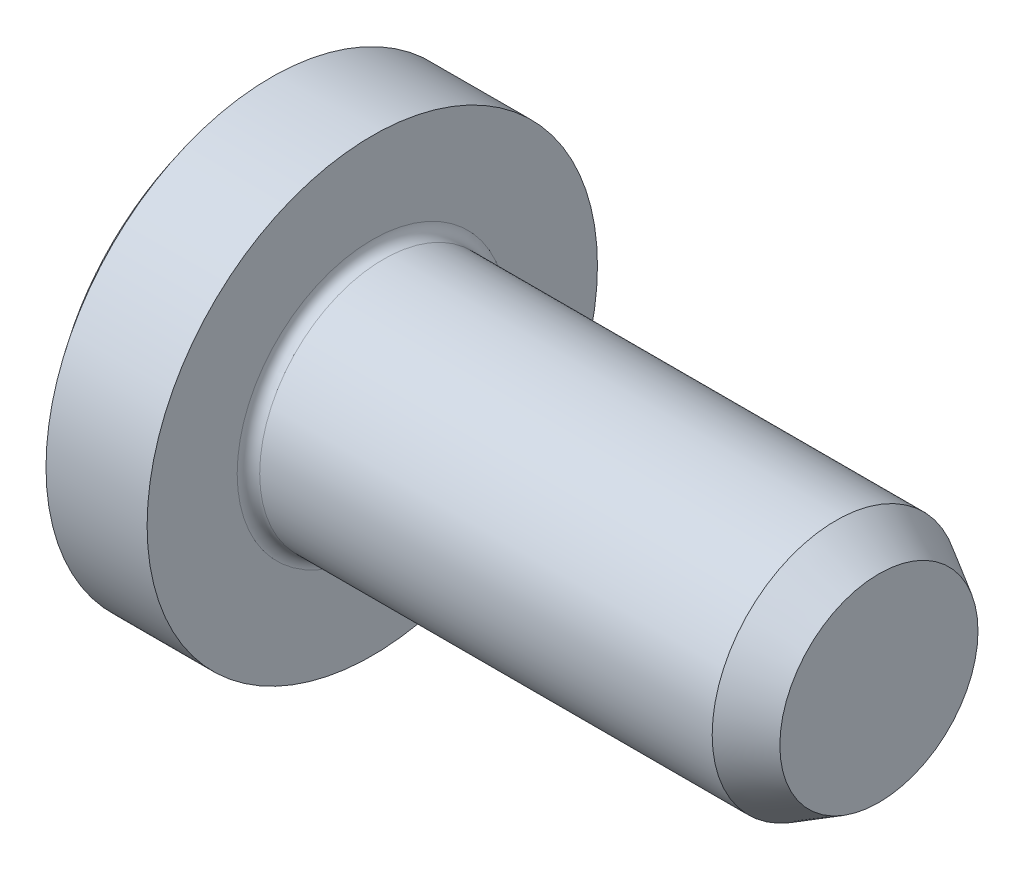
from build123d import *

# Parameters (mm, degrees)
CHAMFER1_SIZE      = 0.22
CHAMFER1_SIZE2     = 0.381051178
CUT_EXTRUDE1_DEPTH = 0.8
CUT_EXTRUDE1_TAPER = 6
FILLET1_R          = 0.1


with BuildPart() as part:
    # Sketch1 → Revolve1 (revolve)
    with BuildSketch(Plane.XY):
        with BuildLine():
            Line((0, 2), (-0.897999199, 2))
            ThreePointArc((-0.897999199, 2), (-1.419403703, 1.059811908), (-1.6, 0))
            Line((-1.6, 0), (4.5, 0))
            Line((4.5, 0), (4.5, 1.1))
            Line((4.5, 1.1), (0, 1.1))
            Line((0, 1.1), (0, 2))
        make_face()
    revolve(axis=Axis((0, 0, 0), (1, 0, 0)))

    # Chamfer1
    chamfer1_edges = [part.edges().sort_by_distance(p)[0] for p in [
        (4.5, -1.1, 0),
    ]]
    chamfer1_side = [part.faces().sort_by_distance(p)[0] for p in [
        (4.5, 0, 0),
    ]]
    chamfer(chamfer1_edges, length=CHAMFER1_SIZE, length2=CHAMFER1_SIZE2, reference=chamfer1_side[0])

    # Sketch3 → Cut-Extrude1 (cut)
    with BuildSketch(Plane(origin=(-1.6, 0, 0), x_dir=(0, 0, -1), z_dir=(1, 0, 0))):
        Polygon((-0.2375, 0.95), (-0.1425, 0.57), (-0.29897586, 0.29897586), (-0.57, 0.1425), (-0.95, 0.2375), (-0.95, -0.2375), (-0.57, -0.1425), (-0.29897586, -0.29897586), (-0.1425, -0.57), (-0.2375, -0.95), (0.2375, -0.95), (0.1425, -0.57), (0.29897586, -0.29897586), (0.57, -0.1425), (0.95, -0.2375), (0.95, 0.2375), (0.57, 0.1425), (0.29897586, 0.29897586), (0.1425, 0.57), (0.2375, 0.95), align=None)
    extrude(amount=CUT_EXTRUDE1_DEPTH, taper=CUT_EXTRUDE1_TAPER, mode=Mode.SUBTRACT)

    # Fillet1
    fillet1_edges = [part.edges().sort_by_distance(p)[0] for p in [
        (0, -1.1, 0),
    ]]
    fillet(fillet1_edges, radius=FILLET1_R)


solid = part.part
